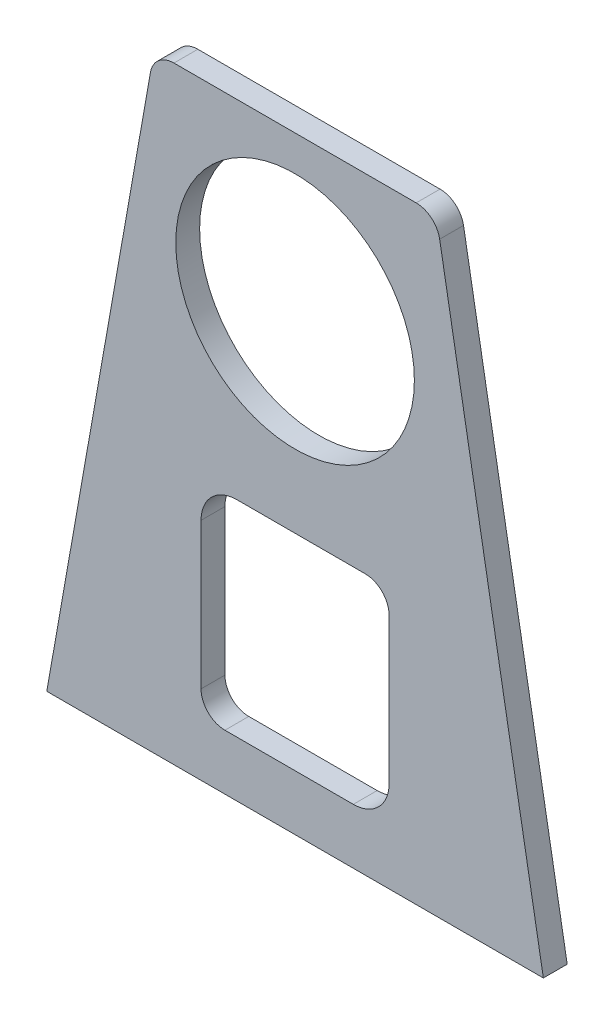
from build123d import *

# Parameters (mm, degrees)
SKETCH3_R           = 250
BOSS_EXTRUDE1_DEPTH = 50


with BuildPart() as part:
    # Sketch3 → Boss-Extrude1 (new body)
    with BuildSketch(Plane.XY):
        with BuildLine():
            Line((-242.735441072, 1232.201966662), (-460.005893477, 0))
            Line((-460.005893477, 0), (580.593733541, 0))
            Line((580.593733541, 0), (363.323281136, 1232.201966662))
            ThreePointArc((363.323281136, 1232.201966662), (346.22227397, 1261.821779935), (314.082893486, 1273.519557779))
            Line((314.082893486, 1273.519557779), (-193.495053421, 1273.519557779))
            ThreePointArc((-193.495053421, 1273.519557779), (-225.634433906, 1261.821779935), (-242.735441072, 1232.201966662))
        make_face()
        with BuildLine():
            Line((182.322496441, 116.059707552), (-86.734656377, 116.059707552))
            ThreePointArc((-86.734656377, 116.059707552), (-122.089995436, 130.704368493), (-136.734656377, 166.059707552))
            Line((-136.734656377, 166.059707552), (-136.734656377, 471.970475316))
            ThreePointArc((-136.734656377, 471.970475316), (-114.767664966, 525.003483905), (-61.734656377, 546.970475316))
            Line((-61.734656377, 546.970475316), (207.322496441, 546.970475316))
            ThreePointArc((207.322496441, 546.970475316), (242.6778355, 532.325814375), (257.322496441, 496.970475316))
            Line((257.322496441, 496.970475316), (257.322496441, 191.059707552))
            ThreePointArc((257.322496441, 191.059707552), (235.35550503, 138.026698963), (182.322496441, 116.059707552))
        make_face(mode=Mode.SUBTRACT)
        with Locations((60.293920032, 949.601893026)):
            Circle(SKETCH3_R, mode=Mode.SUBTRACT)
    extrude(amount=BOSS_EXTRUDE1_DEPTH)


solid = part.part
